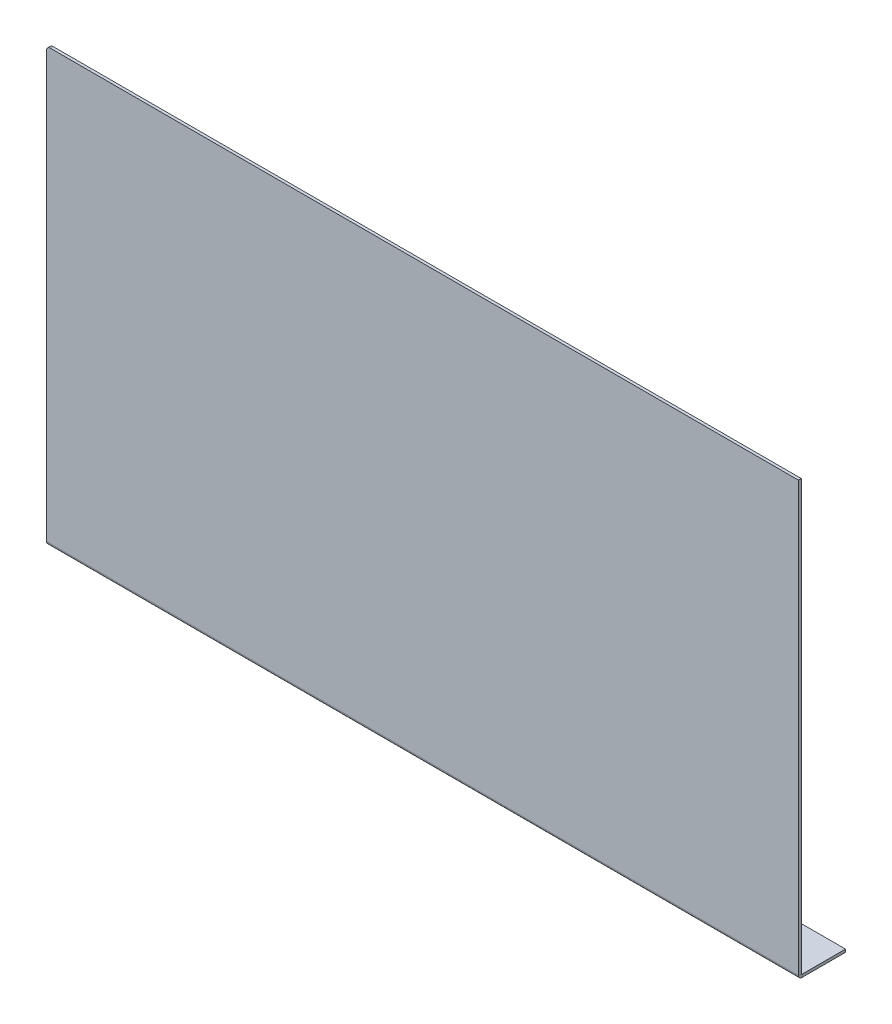
from build123d import *

# Parameters (mm, degrees)
SKETCH_1_W                        = 400
SKETCH_1_H                        = 230
SM_BASE_FLANGE_1_DEPTH            = 1.5
SM_EDGE_FLANGE_1_STRIP_W          = 6.6
SM_EDGE_FLANGE_1_STRIP_H          = 1.5
SM_EDGE_FLANGE_1_STRIP_CUT_DEPTH  = 400
SM_EDGE_FLANGE_1_DEPTH            = 400
SM_EDGE_FLANGE_2_STRIP_W          = 7
SM_EDGE_FLANGE_2_STRIP_H          = 1.5
SM_EDGE_FLANGE_2_STRIP_CUT_DEPTH  = 353
SM_EDGE_FLANGE_2_RELIEF_W         = 7.75
SM_EDGE_FLANGE_2_RELIEF_H         = 0.75
SM_EDGE_FLANGE_2_RELIEF_CUT_DEPTH = 1.5
SM_EDGE_FLANGE_2_DEPTH            = 353
FILLET_1_R                        = 2
SM_START                          = -176.5
SM_EDGE_FLANGE_3_DEPTH            = 353
SM_EDGE_FLANGE_3_2_DEPTH          = 353
SM_BASE_FLANGE_1_2_DEPTH          = 1.5


# Read off the part's stored shape, not the designer's step: 边线-法兰3
# Sheet-metal steps are written as plain solids
with BuildPart() as part:
    # Sketch 1 → Sm Base Flange 1 (new body)
    with BuildSketch(Plane.XY):
        Rectangle(SKETCH_1_W, SKETCH_1_H)
    extrude(amount=-SM_BASE_FLANGE_1_DEPTH)

    # 边线-法兰1 strip (across the edge) → 边线-法兰1 strip cut (cut)
    with BuildSketch(Plane(origin=(200, -115, -1.5), x_dir=(0, 1, 0), z_dir=(-1, 0, 0))):
        with Locations((-1.5, -0.75)):
            Rectangle(SM_EDGE_FLANGE_1_STRIP_W, SM_EDGE_FLANGE_1_STRIP_H)
    extrude(amount=SM_EDGE_FLANGE_1_STRIP_CUT_DEPTH, mode=Mode.SUBTRACT)

    # 边线-法兰1 section (across the edge) → 边线-法兰1 (add)
    with BuildSketch(Plane(origin=(200, -115, -1.5), x_dir=(0, 1, 0), z_dir=(-1, 0, 0))):
        with BuildLine():
            Line((0, 0.3), (0, 23.5))
            Line((0, 23.5), (1.5, 23.5))
            Line((1.5, 23.5), (1.5, 0.3))
            ThreePointArc((1.5, 0.3), (1.587867966, 0.087867966), (1.8, 0))
            Line((1.8, 0), (1.8, -1.5))
            ThreePointArc((1.8, -1.5), (0.527207794, -0.972792206), (0, 0.3))
        make_face()
    extrude(amount=SM_EDGE_FLANGE_1_DEPTH)

    # 边线-法兰2 strip (across the edge) → 边线-法兰2 strip cut (cut)
    with BuildSketch(Plane(origin=(-176.5, -115, -25), x_dir=(0, 0, 1), z_dir=(1, 0, 0))):
        with Locations((-1.5, -0.75)):
            Rectangle(SM_EDGE_FLANGE_2_STRIP_W, SM_EDGE_FLANGE_2_STRIP_H)
    extrude(amount=SM_EDGE_FLANGE_2_STRIP_CUT_DEPTH, mode=Mode.SUBTRACT)

    # 边线-法兰2 relief (on the sheet) → 边线-法兰2 relief cut (cut)
    with BuildSketch(Plane(origin=(-176.5, -115, -23), x_dir=(0, 0, 1), z_dir=(0, -1, 0))):
        with Locations((-3.125, 0.375)):
            Rectangle(SM_EDGE_FLANGE_2_RELIEF_W, SM_EDGE_FLANGE_2_RELIEF_H)
        with Locations((-3.125, -353.375)):
            Rectangle(SM_EDGE_FLANGE_2_RELIEF_W, SM_EDGE_FLANGE_2_RELIEF_H)
    extrude(amount=-SM_EDGE_FLANGE_2_RELIEF_CUT_DEPTH, mode=Mode.SUBTRACT)

    # 边线-法兰2 section (across the edge) → 边线-法兰2 (add)
    with BuildSketch(Plane(origin=(-176.5, -115, -25), x_dir=(0, 0, 1), z_dir=(1, 0, 0))):
        with BuildLine():
            Line((0, 0.5), (0, 9.5))
            Line((0, 9.5), (1.5, 9.5))
            Line((1.5, 9.5), (1.5, 0.5))
            ThreePointArc((1.5, 0.5), (1.646446609, 0.146446609), (2, 0))
            Line((2, 0), (2, -1.5))
            ThreePointArc((2, -1.5), (0.585786438, -0.914213562), (0, 0.5))
        make_face()
    extrude(amount=SM_EDGE_FLANGE_2_DEPTH)

    # 圆角1
    fillet_1_edges = [part.edges().sort_by_distance(p)[0] for p in [
        (-200, 115, -0.75),
    ]]
    fillet(fillet_1_edges, radius=FILLET_1_R)

    # 边线-法兰3 outline → 边线-法兰3 (cut)
    with BuildSketch(Plane.YZ.offset(SM_START)):
        with BuildLine():
            ThreePointArc((-122.171572875, -25), (-122.93693974, -24.847759065), (-123.585786438, -24.414213562))
            Line((-123.585786438, -24.414213562), (-124.5, -23.5))
            Line((-124.5, -23.5), (-124.5, -25))
            Line((-124.5, -25), (-122.171572875, -25))
        make_face()
    extrude(amount=SM_EDGE_FLANGE_3_DEPTH, mode=Mode.SUBTRACT)

    # Sm Edge Flange 3 2 outline → Sm Edge Flange 3 2 (add)
    with BuildSketch(Plane.YZ.offset(SM_START)):
        with BuildLine():
            Line((-129.096194078, -18.903805922), (-124.5, -23.5))
            Line((-124.5, -23.5), (-122.171572875, -23.5))
            ThreePointArc((-122.171572875, -23.5), (-122.362914591, -23.461939766), (-122.525126266, -23.353553391))
            Line((-122.525126266, -23.353553391), (-128.035533906, -17.843145751))
            Line((-128.035533906, -17.843145751), (-129.096194078, -18.903805922))
        make_face()
    extrude(amount=SM_EDGE_FLANGE_3_2_DEPTH)

    # 草图40 → Sm Base Flange 1 2 (add)
    with BuildSketch(Plane(origin=(0, -74, -74), x_dir=(1, 0, 0), z_dir=(0, -0.7071067811865435, -0.7071067811865516))):
        Polygon((176.5, 77.9177849), (182.5, 77.9177849), (176.5, 70.124891681), align=None)
        Polygon((-176.5, 77.9177849), (-182.5, 77.9177849), (-176.5, 70.124891681), align=None)
    extrude(amount=-SM_BASE_FLANGE_1_2_DEPTH)


solid = part.part
